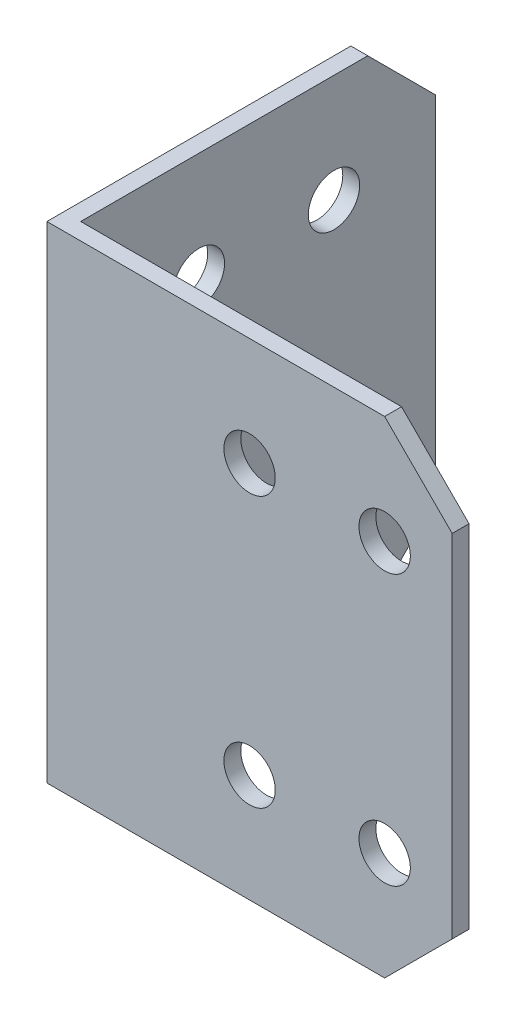
from build123d import *

# Parameters (mm, degrees)
BOSS_EXTRUDE1_DEPTH = 45.72
SKETCH2_R           = 2.413
CUT_EXTRUDE1_DEPTH  = 61.011140812
SKETCH3_R           = 2.413
CUT_EXTRUDE2_DEPTH  = 66.089591564
CHAMFER1_SIZE       = 6.35


with BuildPart() as part:
    # Sketch1 → Boss-Extrude1 (new body)
    with BuildSketch(Plane(origin=(0, 0, 0), x_dir=(1, 0, 0), z_dir=(0, 1, 0))):
        Polygon((-18.109259259, 28.516203704), (-16.521759259, 28.516203704), (-16.521759259, -4.821296296), (19.990740741, -4.821296296), (19.990740741, -6.408796296), (-18.109259259, -6.408796296), align=None)
    extrude(amount=BOSS_EXTRUDE1_DEPTH)

    # Sketch2 → Cut-Extrude1 (cut, through all)
    with BuildSketch(Plane(origin=(0, 0, 4.821296296), x_dir=(-1, 0, 0), z_dir=(0, 0, -1))):
        with Locations((-0.940740741, 35.56)):
            Circle(SKETCH2_R)
        with Locations((-13.640740741, 35.56)):
            Circle(SKETCH2_R)
        with Locations((-13.640740741, 10.16)):
            Circle(SKETCH2_R)
        with Locations((-0.940740741, 10.16)):
            Circle(SKETCH2_R)
    extrude(amount=-CUT_EXTRUDE1_DEPTH, mode=Mode.SUBTRACT)

    # Sketch3 → Cut-Extrude2 (cut, through all)
    with BuildSketch(Plane(origin=(-16.521759259, 0, 0), x_dir=(0, 0, -1), z_dir=(1, 0, 0))):
        with Locations((6.291203704, 35.56)):
            Circle(SKETCH3_R)
        with Locations((18.991203704, 35.56)):
            Circle(SKETCH3_R)
        with Locations((18.991203704, 10.16)):
            Circle(SKETCH3_R)
        with Locations((6.291203704, 10.16)):
            Circle(SKETCH3_R)
    extrude(amount=-CUT_EXTRUDE2_DEPTH, mode=Mode.SUBTRACT)

    # Chamfer1
    chamfer1_edges = [part.edges().sort_by_distance(p)[0] for p in [
        (19.990740741, 45.72, 5.615046296),
        (19.990740741, 0, 5.615046296),
        (-17.315509259, 0, -28.516203704),
        (-17.315509259, 45.72, -28.516203704),
    ]]
    chamfer(chamfer1_edges, length=CHAMFER1_SIZE)


solid = part.part
